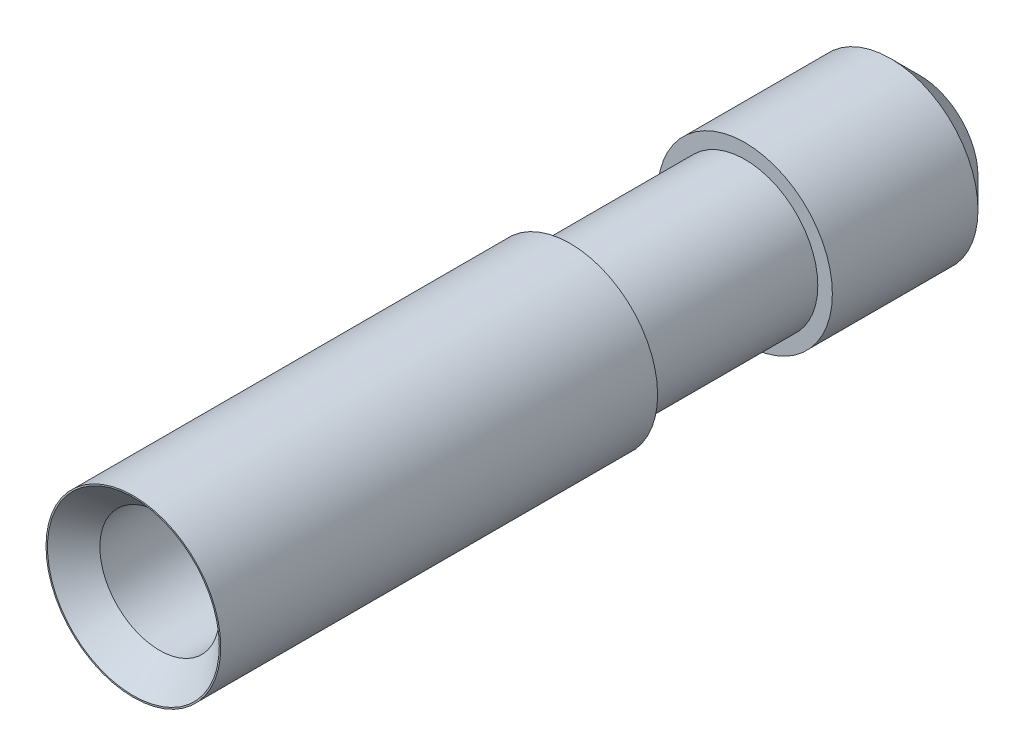
from build123d import *

# Parameters (mm, degrees)
ESQUISSE1_R                         = 3
BOSS_EXTRU_1_DEPTH                  = 27
DIAM_TRE_DU_PER_AGE_2_0_2_1_D       = 2
DIAM_TRE_DU_PER_AGE_2_0_2_1_DEPTH   = 3
ENL_V_START                         = -15
ESQUISSE6_W                         = 11.750178357
ESQUISSE6_H                         = 11.384595502
ESQUISSE6_R                         = 2.5
ENL_V_MAT_EXTRU_1_DEPTH             = 6
CHANFREIN1_SIZE                     = 1
DIAM_TRE_DU_PER_AGE_4_1_4_1_1_D     = 4.1
DIAM_TRE_DU_PER_AGE_4_1_4_1_1_DEPTH = 24
CHANFREIN3_SIZE                     = 0.9


with BuildPart() as part:
    # Esquisse1 → Boss.-Extru.1 (new body)
    with BuildSketch(Plane.XY):
        Circle(ESQUISSE1_R)
    extrude(amount=BOSS_EXTRU_1_DEPTH)

    # Diamètre du perçage Ø2.0 (2)1
    with Locations(Plane(origin=(0, 0, 0), x_dir=(-1, 0, 0), z_dir=(0, 0, -1))):
        with Locations((0, 0)):
            Hole(DIAM_TRE_DU_PER_AGE_2_0_2_1_D / 2, depth=DIAM_TRE_DU_PER_AGE_2_0_2_1_DEPTH)

    # Esquisse6 → Enlèv. mat.-Extru.1 (cut)
    with BuildSketch(Plane.XY.offset(27).offset(ENL_V_START)):
        with Locations((-0.219764127, 0.428836611)):
            Rectangle(ESQUISSE6_W, ESQUISSE6_H)
        Circle(ESQUISSE6_R, mode=Mode.SUBTRACT)
    extrude(amount=-ENL_V_MAT_EXTRU_1_DEPTH, mode=Mode.SUBTRACT)

    # Chanfrein1
    chanfrein1_edges = [part.edges().sort_by_distance(p)[0] for p in [
        (-3, 0, 0),
    ]]
    chamfer(chanfrein1_edges, length=CHANFREIN1_SIZE)

    # Diamètre du perçage Ø4.1 (4.1)1
    with Locations(Plane.XY.offset(27)):
        with Locations((0, 0)):
            Hole(DIAM_TRE_DU_PER_AGE_4_1_4_1_1_D / 2, depth=DIAM_TRE_DU_PER_AGE_4_1_4_1_1_DEPTH)

    # Chanfrein3
    chanfrein3_edges = [part.edges().sort_by_distance(p)[0] for p in [
        (2.05, 0, 27),
    ]]
    chamfer(chanfrein3_edges, length=CHANFREIN3_SIZE)


solid = part.part
